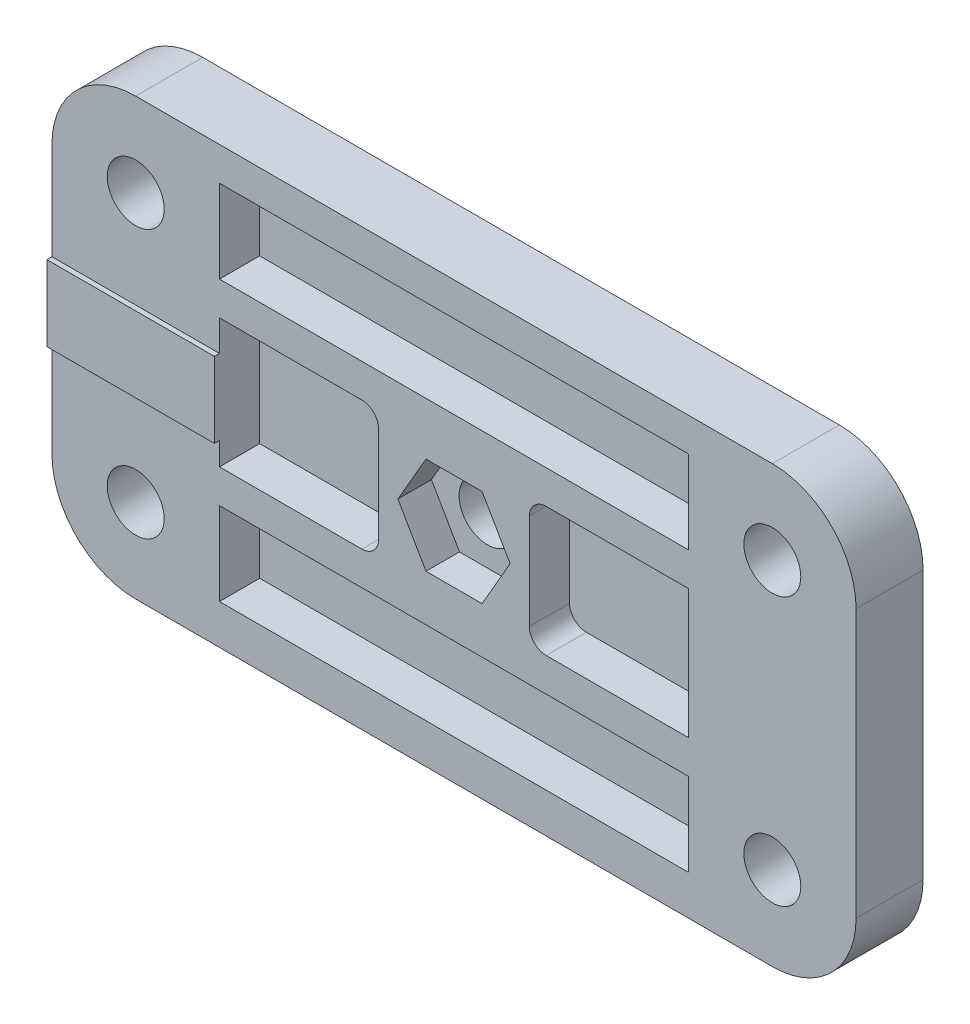
from build123d import *

# Parameters (mm, degrees)
SKETCH1_R           = 1.7
BOSS_EXTRUDE1_DEPTH = 4
CUT_EXTRUDE1_DEPTH  = 2
SKETCH3_W           = 28
SKETCH3_H           = 4.960661027
SKETCH3_W_2         = 9.5
SKETCH3_H_2         = 7.70604726
SKETCH3_H_3         = 4.960661028
CUT_EXTRUDE2_DEPTH  = 2.4
FILLET1_R           = 1
SKETCH4_W           = 10
SKETCH4_H           = 4.5
BOSS_EXTRUDE2_DEPTH = 0.3


with BuildPart() as part:
    # Sketch1 → Boss-Extrude1 (new body)
    with BuildSketch(Plane.XY):
        with BuildLine():
            Line((-19, -13), (19, -13))
            ThreePointArc((19, -13), (22.535533906, -11.535533906), (24, -8))
            Line((24, -8), (24, 8))
            ThreePointArc((24, 8), (22.535533906, 11.535533906), (19, 13))
            Line((19, 13), (-19, 13))
            ThreePointArc((-19, 13), (-22.535533906, 11.535533906), (-24, 8))
            Line((-24, 8), (-24, -8))
            ThreePointArc((-24, -8), (-22.535533906, -11.535533906), (-19, -13))
        make_face()
        Circle(SKETCH1_R, mode=Mode.SUBTRACT)
        with Locations((19, 8)):
            Circle(SKETCH1_R, mode=Mode.SUBTRACT)
        with Locations((19, -8)):
            Circle(SKETCH1_R, mode=Mode.SUBTRACT)
        with Locations((-19, -8)):
            Circle(SKETCH1_R, mode=Mode.SUBTRACT)
        with Locations((-19, 8)):
            Circle(SKETCH1_R, mode=Mode.SUBTRACT)
    extrude(amount=BOSS_EXTRUDE1_DEPTH)

    # Sketch2 → Cut-Extrude1 (cut)
    with BuildSketch(Plane.XY.offset(4)):
        Polygon((3.348631561, 0), (1.674315781, 2.9), (-1.674315781, 2.9), (-3.348631561, 0), (-1.674315781, -2.9), (1.674315781, -2.9), align=None)
    extrude(amount=-CUT_EXTRUDE1_DEPTH, mode=Mode.SUBTRACT)

    # Sketch3 → Cut-Extrude2 (cut)
    with BuildSketch(Plane.XY.offset(4)):
        with Locations((0, 8.519669486)):
            Rectangle(SKETCH3_W, SKETCH3_H)
        with Locations((-9.25, 0.186315343)):
            Rectangle(SKETCH3_W_2, SKETCH3_H_2)
        with Locations((9.25, 0.186315343)):
            Rectangle(SKETCH3_W_2, SKETCH3_H_2)
        with Locations((0, -8.147038801)):
            Rectangle(SKETCH3_W, SKETCH3_H_3)
    extrude(amount=-CUT_EXTRUDE2_DEPTH, mode=Mode.SUBTRACT)

    # Fillet1
    fillet1_edges = [part.edges().sort_by_distance(p)[0] for p in [
        (4.5, -3.666708287, 2.8),
        (4.5, 4.039338973, 2.8),
        (-4.5, -3.666708287, 2.8),
        (-4.5, 4.039338973, 2.8),
    ]]
    fillet(fillet1_edges, radius=FILLET1_R)

    # Sketch4 → Boss-Extrude2 (add)
    with BuildSketch(Plane.XY.offset(4)):
        with Locations((-19, -0.053835306)):
            Rectangle(SKETCH4_W, SKETCH4_H)
    extrude(amount=BOSS_EXTRUDE2_DEPTH)


solid = part.part
